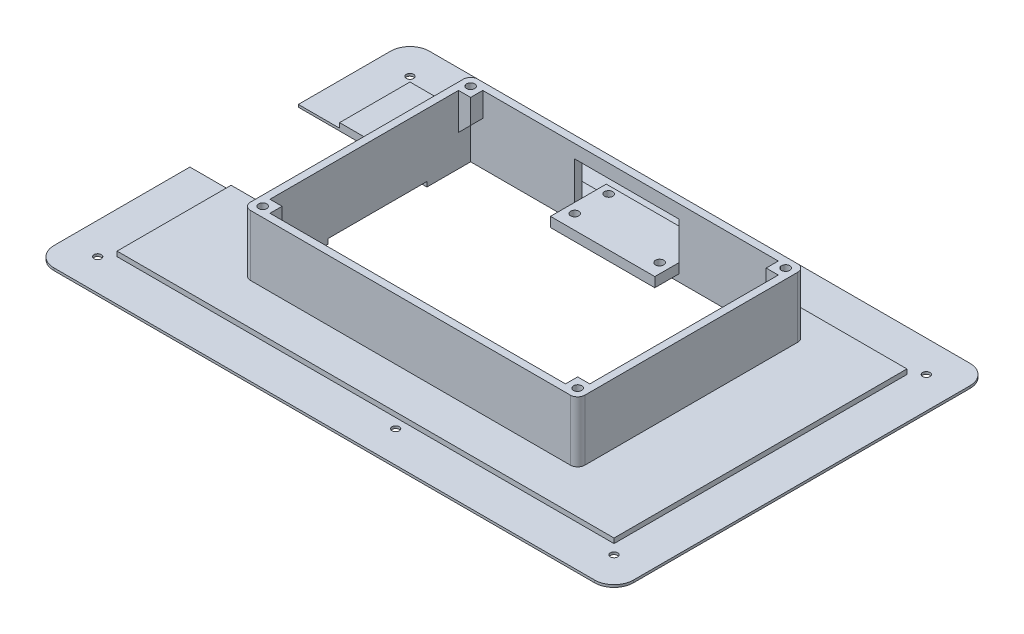
from build123d import *

# Parameters (mm, degrees)
SKIZZE1_W                            = 238.8
SKIZZE1_H                            = 154.7
AUFSATZ_LINEAR_AUSTRAGEN1_DEPTH      = 3
SKIZZE2_W                            = 238.8
SKIZZE2_H                            = 154.7
SKIZZE2_W_2                          = 204.8
SKIZZE2_H_2                          = 120.7
SCHNITT_LINEAR_AUSTRAGEN2_DEPTH      = 2
VERRUNDUNG3_R                        = 8
F_3_0_3_DURCHMESSER_BOHRUNG1_D       = 3
SKIZZE6_W                            = 52
SKIZZE6_H                            = 44.7
SCHNITT_LINEAR_AUSTRAGEN3_DEPTH      = 285.546182543
SKIZZE7_W                            = 131.8
SKIZZE7_H                            = 87.7
SCHNITT_LINEAR_AUSTRAGEN4_DEPTH      = 285.546182543
SKIZZE5_W                            = 137.8
SKIZZE5_H                            = 93.7
SKIZZE5_W_2                          = 131.8
SKIZZE5_H_2                          = 87.7
AUFSATZ_LINEAR_AUSTRAGEN2_DEPTH      = 25
SCHNITT_LINEAR_AUSTRAGEN5_REACH      = 246.152
SKIZZE8_W                            = 40.7
SKIZZE8_H                            = 2
SKIZZE9_W                            = 43
SKIZZE9_H                            = 23
AUFSATZ_LINEAR_AUSTRAGEN3_DEPTH      = 4
F_3_4_3_4_DURCHMESSER_BOHRUNG1_D     = 3.4
F_3_4_3_4_DURCHMESSER_BOHRUNG1_DEPTH = 6
F_3_4_3_4_DURCHMESSER_BOHRUNG1_TIP   = 1.021463052
SCHNITT_LINEAR_AUSTRAGEN6_REACH      = 274.244
SKIZZE12_W                           = 43
SKIZZE12_H                           = 15.5
SKIZZE13_W                           = 5
SKIZZE13_H                           = 5
AUFSATZ_LINEAR_AUSTRAGEN4_DEPTH      = 15
F_3_4_3_4_DURCHMESSER_BOHRUNG2_D     = 3.4
F_3_4_3_4_DURCHMESSER_BOHRUNG2_DEPTH = 8
F_3_4_3_4_DURCHMESSER_BOHRUNG2_TIP   = 1.021463052
FASE1_SIZE                           = 5
VERRUNDUNG4_R                        = 3


with BuildPart() as part:
    # Skizze1 → Aufsatz-Linear austragen1 (new body)
    with BuildSketch(Plane(origin=(0, 0, 0), x_dir=(1, 0, 0), z_dir=(0, 1, 0))):
        with Locations((119.4, 77.35)):
            Rectangle(SKIZZE1_W, SKIZZE1_H)
    extrude(amount=AUFSATZ_LINEAR_AUSTRAGEN1_DEPTH)

    # Skizze2 → Schnitt-Linear austragen2 (cut)
    with BuildSketch(Plane(origin=(0, 3, 0), x_dir=(1, 0, 0), z_dir=(0, 1, 0))):
        with Locations((119.4, 77.35)):
            Rectangle(SKIZZE2_W, SKIZZE2_H)
        with Locations((119.4, 77.35)):
            Rectangle(SKIZZE2_W_2, SKIZZE2_H_2, mode=Mode.SUBTRACT)
    extrude(amount=-SCHNITT_LINEAR_AUSTRAGEN2_DEPTH, mode=Mode.SUBTRACT)

    # Verrundung3
    verrundung3_edges = [part.edges().sort_by_distance(p)[0] for p in [
        (0, 0.5, -154.7),
        (238.8, 0.5, -154.7),
        (238.8, 0.5, 0),
        (0, 0.5, 0),
    ]]
    fillet(verrundung3_edges, radius=VERRUNDUNG3_R)

    # Ø3.0 (3) Durchmesser Bohrung1 (through all)
    with Locations(Plane(origin=(0, 1, 0), x_dir=(1, 0, 0), z_dir=(0, 1, 0))):
        with Locations((13, 13), (135.8, 13), (225.8, 13), (225.8, 141.7), (135.8, 141.7), (13, 141.7)):
            Hole(F_3_0_3_DURCHMESSER_BOHRUNG1_D / 2)

    # Skizze6 → Schnitt-Linear austragen3 (cut, through all)
    with BuildSketch(Plane(origin=(0, 3, 0), x_dir=(1, 0, 0), z_dir=(0, 1, 0))):
        with Locations((26, 86.35)):
            Rectangle(SKIZZE6_W, SKIZZE6_H)
    extrude(amount=-SCHNITT_LINEAR_AUSTRAGEN3_DEPTH, mode=Mode.SUBTRACT)

    # Skizze7 → Schnitt-Linear austragen4 (cut, through all)
    with BuildSketch(Plane(origin=(0, 3, 0), x_dir=(1, 0, 0), z_dir=(0, 1, 0))):
        with Locations((120.9, 80.85)):
            Rectangle(SKIZZE7_W, SKIZZE7_H)
    extrude(amount=-SCHNITT_LINEAR_AUSTRAGEN4_DEPTH, mode=Mode.SUBTRACT)

    # Skizze5 → Aufsatz-Linear austragen2 (add)
    with BuildSketch(Plane(origin=(0, 3, 0), x_dir=(1, 0, 0), z_dir=(0, 1, 0))):
        with Locations((120.9, 80.85)):
            Rectangle(SKIZZE5_W, SKIZZE5_H)
        with Locations((120.9, 80.85)):
            Rectangle(SKIZZE5_W_2, SKIZZE5_H_2, mode=Mode.SUBTRACT)
    extrude(amount=AUFSATZ_LINEAR_AUSTRAGEN2_DEPTH)

    # Skizze8 → Schnitt-Linear austragen5 (cut, up to next)
    with BuildSketch(Plane.ZY.offset(-52), mode=Mode.PRIVATE) as schnitt_linear_austragen5_sk1:
        with Locations((-86.35, 1)):
            Rectangle(SKIZZE8_W, SKIZZE8_H)
    schnitt_linear_austragen5_tool1 = extrude(schnitt_linear_austragen5_sk1.sketch, amount=-SCHNITT_LINEAR_AUSTRAGEN5_REACH, mode=Mode.PRIVATE) & part.part
    add(schnitt_linear_austragen5_tool1.solids().sort_by_distance((52, 1, -86.35))[0], mode=Mode.SUBTRACT)

    # Skizze9 → Aufsatz-Linear austragen3 (add)
    with BuildSketch(Plane(origin=(0, 3, 0), x_dir=(1, 0, 0), z_dir=(0, 1, 0))):
        with Locations((119.4, 126.2)):
            Rectangle(SKIZZE9_W, SKIZZE9_H)
    extrude(amount=AUFSATZ_LINEAR_AUSTRAGEN3_DEPTH)

    # Ø3.4 (3.4) Durchmesser Bohrung1
    with Locations(Plane(origin=(0, 7, 0), x_dir=(1, 0, 0), z_dir=(0, 1, 0))):
        with Locations((101.9, 134.7), (136.9, 134.7), (136.9, 120.7), (101.9, 120.7)):
            Hole(F_3_4_3_4_DURCHMESSER_BOHRUNG1_D / 2, depth=F_3_4_3_4_DURCHMESSER_BOHRUNG1_DEPTH)
            with Locations((0, 0, -(F_3_4_3_4_DURCHMESSER_BOHRUNG1_DEPTH + F_3_4_3_4_DURCHMESSER_BOHRUNG1_TIP / 2))):  # 118° drill point
                Cone(0, F_3_4_3_4_DURCHMESSER_BOHRUNG1_D / 2, F_3_4_3_4_DURCHMESSER_BOHRUNG1_TIP, mode=Mode.SUBTRACT)

    # Skizze12 → Schnitt-Linear austragen6 (cut, up to next)
    with BuildSketch(Plane(origin=(0, 0, -127.7), x_dir=(-1, 0, 0), z_dir=(0, 0, -1)), mode=Mode.PRIVATE) as schnitt_linear_austragen6_sk1:
        with Locations((-119.4, 14.75)):
            Rectangle(SKIZZE12_W, SKIZZE12_H)
    schnitt_linear_austragen6_tool1 = extrude(schnitt_linear_austragen6_sk1.sketch, amount=-SCHNITT_LINEAR_AUSTRAGEN6_REACH, mode=Mode.PRIVATE) & part.part
    add(schnitt_linear_austragen6_tool1.solids().sort_by_distance((119.4, 14.75, -127.7))[0], mode=Mode.SUBTRACT)

    # Skizze13 → Aufsatz-Linear austragen4 (add)
    with BuildSketch(Plane(origin=(0, 28, 0), x_dir=(1, 0, 0), z_dir=(0, 1, 0))):
        with Locations((57.5, 122.2)):
            Rectangle(SKIZZE13_W, SKIZZE13_H)
        with Locations((184.3, 122.2)):
            Rectangle(SKIZZE13_W, SKIZZE13_H)
        with Locations((184.3, 39.5)):
            Rectangle(SKIZZE13_W, SKIZZE13_H)
        with Locations((57.5, 39.5)):
            Rectangle(SKIZZE13_W, SKIZZE13_H)
    extrude(amount=-AUFSATZ_LINEAR_AUSTRAGEN4_DEPTH)

    # Ø3.4 (3.4) Durchmesser Bohrung2
    with Locations(Plane(origin=(0, 28, 0), x_dir=(1, 0, 0), z_dir=(0, 1, 0))):
        with Locations((56, 123.7), (185.8, 123.7), (185.8, 38), (56, 38)):
            Hole(F_3_4_3_4_DURCHMESSER_BOHRUNG2_D / 2, depth=F_3_4_3_4_DURCHMESSER_BOHRUNG2_DEPTH)
            with Locations((0, 0, -(F_3_4_3_4_DURCHMESSER_BOHRUNG2_DEPTH + F_3_4_3_4_DURCHMESSER_BOHRUNG2_TIP / 2))):  # 118° drill point
                Cone(0, F_3_4_3_4_DURCHMESSER_BOHRUNG2_D / 2, F_3_4_3_4_DURCHMESSER_BOHRUNG2_TIP, mode=Mode.SUBTRACT)

    # Fase1
    fase1_edges = [part.edges().sort_by_distance(p)[0] for p in [
        (60, 13, -39.5),
        (181.8, 13, -39.5),
        (181.8, 13, -122.2),
        (60, 13, -122.2),
    ]]
    chamfer(fase1_edges, length=FASE1_SIZE - 0.0001)  # a hair under: the kernel refuses the full size

    # Verrundung4
    verrundung4_edges = [part.edges().sort_by_distance(p)[0] for p in [
        (52, 15.5, -127.7),
        (52, 15.5, -34),
        (189.8, 15.5, -34),
        (189.8, 15.5, -127.7),
    ]]
    fillet(verrundung4_edges, radius=VERRUNDUNG4_R)


solid = part.part
